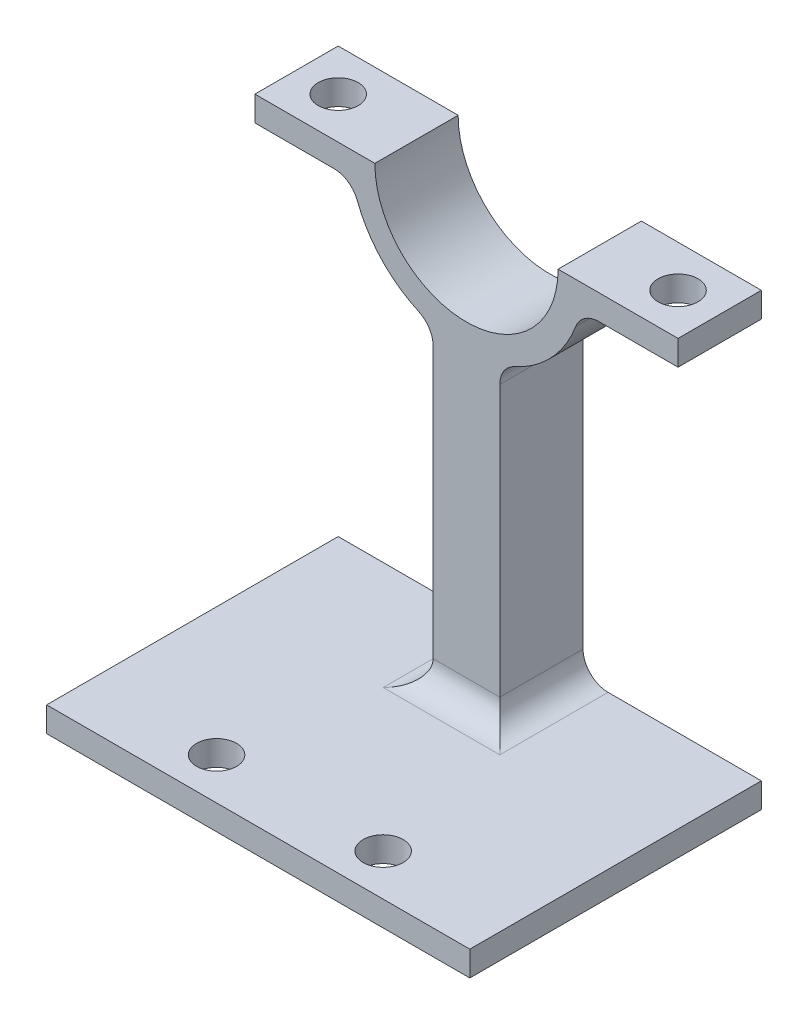
from build123d import *

# Parameters (mm, degrees)
BOSS_EXTRUDE1_DEPTH      = 2.5
SKETCH2_R                = 1.2
CUT_EXTRUDE1_DEPTH       = 15.715298162
BOSS_EXTRUDE2_REACH      = 42.215
BOSS_EXTRUDE2_END_RADIUS = 7
BOSS_EXTRUDE2_START      = -25.5
SKETCH6_W                = 4
SKETCH6_H                = 5
SKETCH7_W                = 25.4
SKETCH7_H                = 17.5
BOSS_EXTRUDE4_DEPTH      = 1.5
FILLET1_R                = 1.5
SKETCH8_R                = 1.2
CUT_EXTRUDE3_DEPTH       = 34.395957839


with BuildPart() as part:
    # Sketch1 → Boss-Extrude1 (new, symmetric)
    with BuildSketch(Plane.XY):
        with BuildLine():
            Line((5.5, 0), (12.7, 0))
            Line((12.7, 0), (12.7, -1.5))
            Line((12.7, -1.5), (6.837397166, -1.5))
            ThreePointArc((6.837397166, -1.5), (0, -7), (-6.837397166, -1.5))
            Line((-6.837397166, -1.5), (-12.7, -1.5))
            Line((-12.7, -1.5), (-12.7, 0))
            Line((-12.7, 0), (-5.5, 0))
            ThreePointArc((-5.5, 0), (0, -5.5), (5.5, 0))
        make_face()
    extrude(amount=BOSS_EXTRUDE1_DEPTH, both=True)

    # Sketch2 → Cut-Extrude1 (cut, through all)
    with BuildSketch(Plane(origin=(0, 0, 0), x_dir=(1, 0, 0), z_dir=(0, 1, 0))):
        with Locations((-10.2, 0)):
            Circle(SKETCH2_R)
        with Locations((10.2, 0)):
            Circle(SKETCH2_R)
    extrude(amount=-CUT_EXTRUDE1_DEPTH, mode=Mode.SUBTRACT)

    # Boss-Extrude2: up to this cylinder (the profile starts outside it)
    boss_extrude2_end = Plane(origin=(0, 0, 0), z_dir=(0, 0, -1)) * Cylinder(BOSS_EXTRUDE2_END_RADIUS, 99.43, mode=Mode.PRIVATE)
    # Sketch6 → Boss-Extrude2 (add, up to the surface)
    with BuildSketch(Plane(origin=(0, 0, 0), x_dir=(1, 0, 0), z_dir=(0, 1, 0)).offset(BOSS_EXTRUDE2_START), mode=Mode.PRIVATE) as boss_extrude2_sk1:
        Rectangle(SKETCH6_W, SKETCH6_H)
    boss_extrude2_tool1 = extrude(boss_extrude2_sk1.sketch, amount=BOSS_EXTRUDE2_REACH, mode=Mode.PRIVATE) - boss_extrude2_end
    add(boss_extrude2_tool1.solids().sort_by_distance((0, -25.5, 0))[0])

    # Sketch7 → Boss-Extrude4 (add)
    with BuildSketch(Plane.XZ.offset(25.5)):
        with Locations((0, 6.25)):
            Rectangle(SKETCH7_W, SKETCH7_H)
    extrude(amount=BOSS_EXTRUDE4_DEPTH)

    # Fillet1
    fillet1_edges = [part.edges().sort_by_distance(p)[0] for p in [
        (2, -25.5, 0),
        (-2, -25.5, 0),
        (-6.837397166, -1.5, 0),
        (-2, -6.708203932, 0),
        (2, -6.708203932, 0),
        (6.837397166, -1.5, 0),
        (0, -25.5, 2.5),
    ]]
    fillet(fillet1_edges, radius=FILLET1_R)

    # Sketch8 → Cut-Extrude3 (cut, through all)
    with BuildSketch(Plane(origin=(0, 0, 0), x_dir=(1, 0, 0), z_dir=(0, 1, 0))):
        with Locations((-5, -12.5)):
            Circle(SKETCH8_R)
        with Locations((5, -12.5)):
            Circle(SKETCH8_R)
    extrude(amount=-CUT_EXTRUDE3_DEPTH, mode=Mode.SUBTRACT)


solid = part.part
